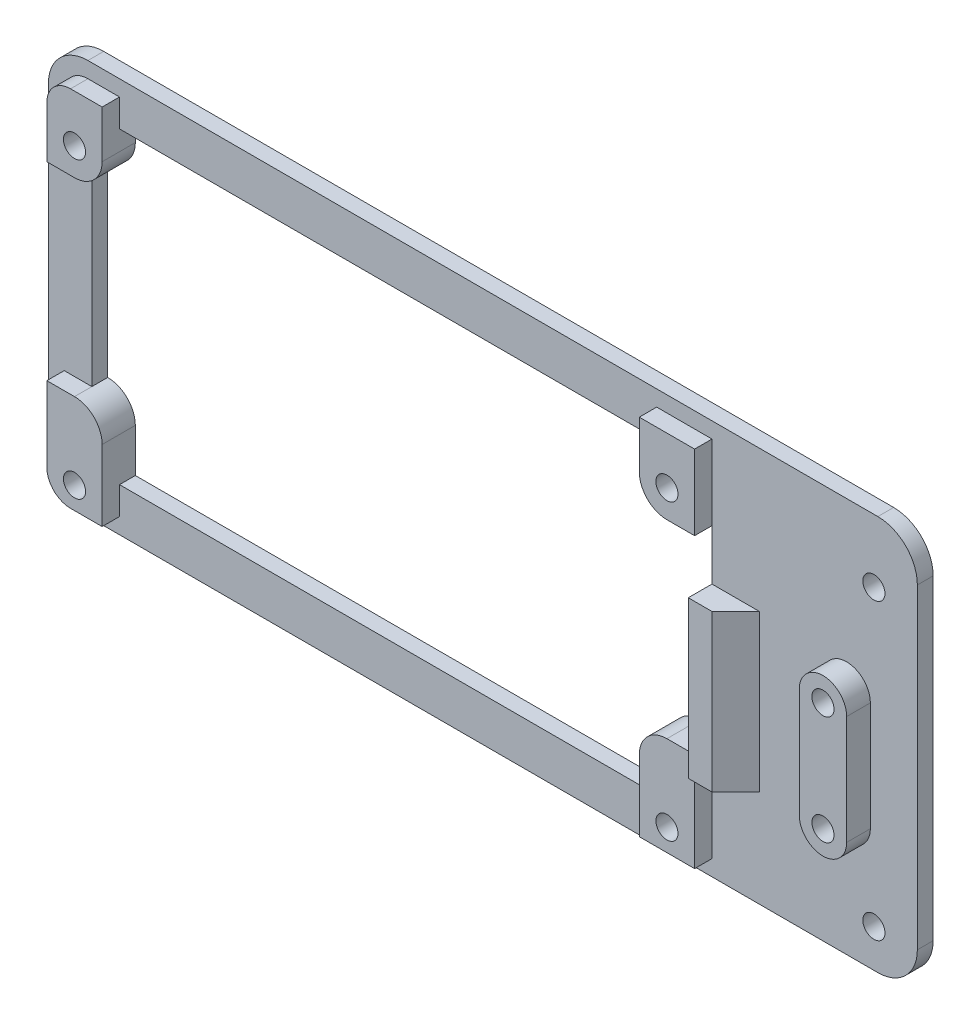
from build123d import *

# Parameters (mm, degrees)
SKICA1_W                 = 110
SKICA1_H                 = 50
SKICA1_W_2               = 82
SKICA1_H_2               = 46
P_IDAT_VYSUNUT_M1_DEPTH  = 2
SKICA2_R                 = 1.4
P_IDAT_VYSUNUT_M2_DEPTH  = 2
ZAOBLIT1_R               = 5
SKICA3_R                 = 1.4
ODEBRAT_VYSUNUT_M1_DEPTH = 2
P_IDAT_START             = 3
SKICA4_R                 = 1.4
P_IDAT_VYSUNUT_M3_DEPTH  = 3
SKICA5_R                 = 1.4
P_IDAT_VYSUNUT_M5_DEPTH  = 2.2
SKICA6_R                 = 1.4
ODEBRAT_VYSUNUT_M2_DEPTH = 2
P_IDAT_VYSUNUT_M6_REACH  = 122.868
SKICA8_W                 = 3
SKICA8_H                 = 19.8
ZKOSEN_1_SIZE            = 3
SKICA9_W                 = 68
SKICA9_H                 = 3.5
SKICA9_W_2               = 3.5
SKICA9_H_2               = 24
P_IDAT_VYSUNUT_M7_DEPTH  = 2


with BuildPart() as part:
    # Skica1 → Přidat vysunutím1 (new body)
    with BuildSketch(Plane.XY):
        with Locations((55, 25)):
            Rectangle(SKICA1_W, SKICA1_H)
        with Locations((43, 25)):
            Rectangle(SKICA1_W_2, SKICA1_H_2, mode=Mode.SUBTRACT)
    extrude(amount=P_IDAT_VYSUNUT_M1_DEPTH)

    # Skica2 → Přidat vysunutím2 (add)
    # profile 1 of 4: a face of its own
    with BuildSketch(Plane(origin=(0, 0, 0), x_dir=(-1, 0, 0), z_dir=(0, 0, -1))):
        with BuildLine():
            Line((-77, 42), (-77, 48))
            Line((-77, 48), (-84, 48))
            Line((-84, 48), (-84, 38.5))
            Line((-84, 38.5), (-80.5, 38.5))
            ThreePointArc((-80.5, 38.5), (-78.025126266, 39.525126266), (-77, 42))
        make_face()
        with Locations((-80.5, 42)):
            Circle(SKICA2_R, mode=Mode.SUBTRACT)
    # profile 2 of 4: a face of its own
    with BuildSketch(Plane(origin=(0, 0, 0), x_dir=(-1, 0, 0), z_dir=(0, 0, -1))):
        with BuildLine():
            Line((-9, 42), (-9, 48))
            Line((-9, 48), (-2, 48))
            Line((-2, 48), (-2, 38.5))
            Line((-2, 38.5), (-5.5, 38.5))
            ThreePointArc((-5.5, 38.5), (-7.974873734, 39.525126266), (-9, 42))
        make_face()
        with Locations((-5.5, 42)):
            Circle(SKICA2_R, mode=Mode.SUBTRACT)
    # profile 3 of 4: a face of its own
    with BuildSketch(Plane(origin=(0, 0, 0), x_dir=(-1, 0, 0), z_dir=(0, 0, -1))):
        with BuildLine():
            Line((-80.5, 14.5), (-84, 14.5))
            Line((-84, 14.5), (-84, 2))
            Line((-84, 2), (-77, 2))
            Line((-77, 2), (-77, 11))
            ThreePointArc((-77, 11), (-78.025126266, 13.474873734), (-80.5, 14.5))
        make_face()
        with Locations((-80.5, 4.8)):
            Circle(SKICA2_R, mode=Mode.SUBTRACT)
    # profile 4 of 4: a face of its own
    with BuildSketch(Plane(origin=(0, 0, 0), x_dir=(-1, 0, 0), z_dir=(0, 0, -1))):
        with BuildLine():
            Line((-5.5, 14.5), (-2, 14.5))
            Line((-2, 14.5), (-2, 2))
            Line((-2, 2), (-9, 2))
            Line((-9, 2), (-9, 11))
            ThreePointArc((-9, 11), (-7.974873734, 13.474873734), (-5.5, 14.5))
        make_face()
        with Locations((-5.5, 4.8)):
            Circle(SKICA2_R, mode=Mode.SUBTRACT)
    extrude(amount=-P_IDAT_VYSUNUT_M2_DEPTH)

    # Zaoblit1
    zaoblit1_edges = [part.edges().sort_by_distance(p)[0] for p in [
        (0, 50, 1),
        (110, 50, 1),
        (110, 0, 1),
        (0, 0, 1),
    ]]
    fillet(zaoblit1_edges, radius=ZAOBLIT1_R)

    # Skica3 → Odebrat vysunutím1 (cut)
    with BuildSketch(Plane.XY.offset(2)):
        with Locations((101.05, 29.1)):
            Circle(SKICA3_R)
        with Locations((101.05, 15.3)):
            Circle(SKICA3_R)
    extrude(amount=-ODEBRAT_VYSUNUT_M1_DEPTH, mode=Mode.SUBTRACT)

    # Skica4 → Přidat vysunutím3 (add)
    with BuildSketch(Plane.XY.offset(2).offset(P_IDAT_START)):
        with BuildLine():
            Line((104.05, 29.1), (104.05, 15.3))
            ThreePointArc((104.05, 15.3), (101.05, 12.3), (98.05, 15.3))
            Line((98.05, 15.3), (98.05, 29.1))
            ThreePointArc((98.05, 29.1), (101.05, 32.1), (104.05, 29.1))
        make_face()
        with Locations((101.05, 15.3)):
            Circle(SKICA4_R, mode=Mode.SUBTRACT)
        with Locations((101.05, 29.1)):
            Circle(SKICA4_R, mode=Mode.SUBTRACT)
    extrude(amount=-P_IDAT_VYSUNUT_M3_DEPTH)

    # Skica5 → Přidat vysunutím5 (add)
    # profile 1 of 4: a face of its own
    with BuildSketch(Plane.XY.offset(2)):
        with BuildLine():
            Line((2, 45), (2, 38.5))
            Line((2, 38.5), (5.5, 38.5))
            ThreePointArc((5.5, 38.5), (7.974873734, 39.525126266), (9, 42))
            Line((9, 42), (9, 48))
            Line((9, 48), (5, 48))
            ThreePointArc((5, 48), (2.878679656, 47.121320344), (2, 45))
        make_face()
        with Locations(Location((5.5, 42, 0), (0, 0, 180))):
            Circle(SKICA5_R, mode=Mode.SUBTRACT)
    # profile 2 of 4: a face of its own
    with BuildSketch(Plane.XY.offset(2)):
        with BuildLine():
            Line((5.5, 14.5), (2, 14.5))
            Line((2, 14.5), (2, 5))
            ThreePointArc((2, 5), (2.878679656, 2.878679656), (5, 2))
            Line((5, 2), (9, 2))
            Line((9, 2), (9, 11))
            ThreePointArc((9, 11), (7.974873734, 13.474873734), (5.5, 14.5))
        make_face()
        with Locations(Location((5.5, 4.8, 0), (0, 0, 180))):
            Circle(SKICA5_R, mode=Mode.SUBTRACT)
    # profile 3 of 4: a face of its own
    with BuildSketch(Plane.XY.offset(2)):
        with BuildLine():
            Line((84, 48), (77, 48))
            Line((77, 48), (77, 42))
            ThreePointArc((77, 42), (78.025126266, 39.525126266), (80.5, 38.5))
            Line((80.5, 38.5), (84, 38.5))
            Line((84, 38.5), (84, 48))
        make_face()
        with Locations(Location((80.5, 42, 0), (0, 0, 180))):
            Circle(SKICA5_R, mode=Mode.SUBTRACT)
    # profile 4 of 4: a face of its own
    with BuildSketch(Plane.XY.offset(2)):
        with BuildLine():
            Line((77, 11), (77, 2))
            Line((77, 2), (84, 2))
            Line((84, 2), (84, 14.5))
            Line((84, 14.5), (80.5, 14.5))
            ThreePointArc((80.5, 14.5), (78.025126266, 13.474873734), (77, 11))
        make_face()
        with Locations(Location((80.5, 4.8, 0), (0, 0, 180))):
            Circle(SKICA5_R, mode=Mode.SUBTRACT)
    extrude(amount=P_IDAT_VYSUNUT_M5_DEPTH)

    # Skica6 → Odebrat vysunutím2 (cut)
    with BuildSketch(Plane(origin=(0, 0, 0), x_dir=(-1, 0, 0), z_dir=(0, 0, -1))):
        with Locations((-104.5, 42)):
            Circle(SKICA6_R)
        with Locations((-104.5, 4.8)):
            Circle(SKICA6_R)
    extrude(amount=-ODEBRAT_VYSUNUT_M2_DEPTH, mode=Mode.SUBTRACT)

    # Přidat vysunutím6: up to this face of the body (flat: up to its plane)
    p_idat_vysunut_m6_end = Plane(part.part.faces().sort_by_distance((101.05, 22.2, 5))[0])
    # Skica8 → Přidat vysunutím6 (add, up to the picked face)
    with BuildSketch(Plane.XY.offset(2), mode=Mode.PRIVATE) as p_idat_vysunut_m6_sk1:
        with Locations((85.5, 22.2)):
            Rectangle(SKICA8_W, SKICA8_H)
    p_idat_vysunut_m6_tool1 = split(extrude(p_idat_vysunut_m6_sk1.sketch, amount=P_IDAT_VYSUNUT_M6_REACH, mode=Mode.PRIVATE), bisect_by=p_idat_vysunut_m6_end, keep=Keep.BOTH, mode=Mode.PRIVATE)
    add(p_idat_vysunut_m6_tool1.solids().sort_by(Axis((85.5, 22.2, 2), (0, 0, 1)))[0])

    # Zkosení1
    zkosen_1_edges = [part.edges().sort_by_distance(p)[0] for p in [
        (87, 22.2, 2),
    ]]
    chamfer(zkosen_1_edges, length=ZKOSEN_1_SIZE - 0.0001)  # a hair under: the kernel refuses the full size

    # Skica9 → Přidat vysunutím7 (add)
    with BuildSketch(Plane(origin=(0, 0, 0), x_dir=(-1, 0, 0), z_dir=(0, 0, -1))):
        with Locations((-43, 3.75)):
            Rectangle(SKICA9_W, SKICA9_H)
        with Locations((-43, 46.25)):
            Rectangle(SKICA9_W, SKICA9_H)
        with Locations((-3.75, 26.5)):
            Rectangle(SKICA9_W_2, SKICA9_H_2)
    extrude(amount=-P_IDAT_VYSUNUT_M7_DEPTH)


solid = part.part
